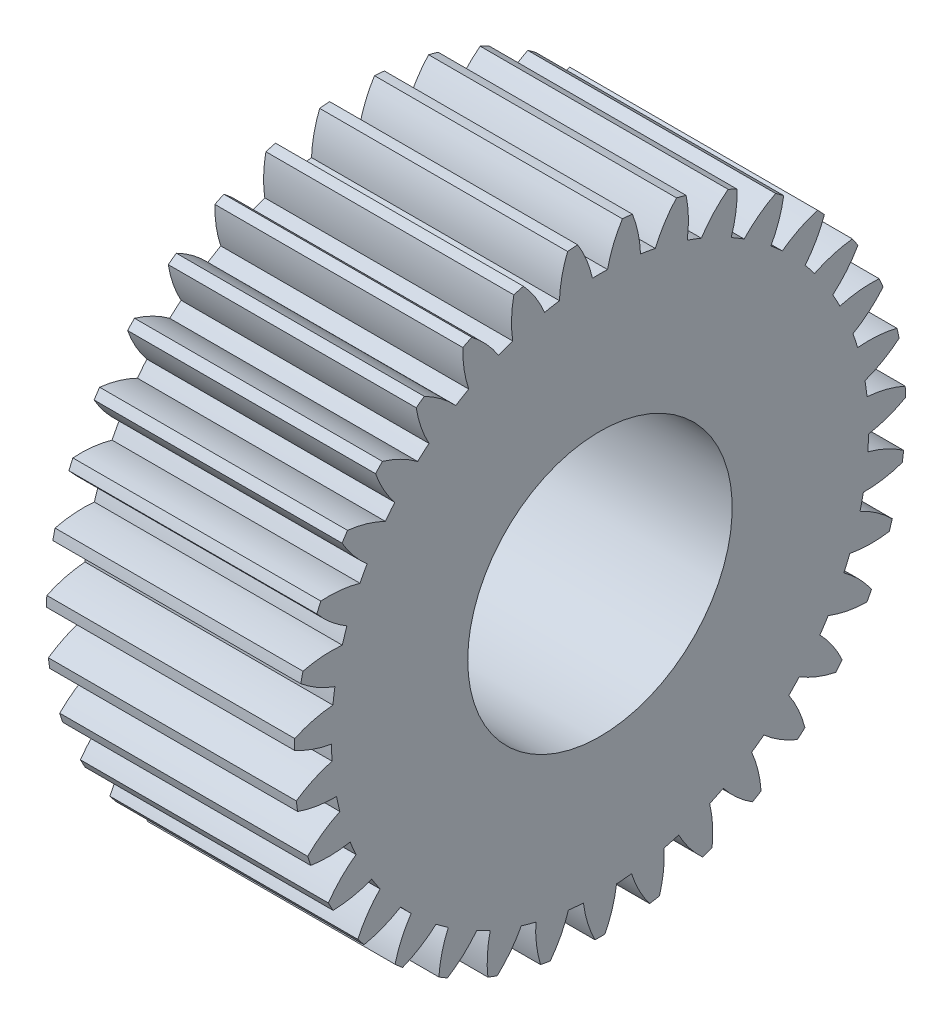
from build123d import *

# Parameters (mm, degrees)
BASPROSKE_W     = 15
BASPROSKE_H     = 18.5
TOOTHCUT_DEPTH  = 31.1579177
TEETHCUTS_COUNT = 35
TEETHCUTS_ANGLE = 349.714285714
BORSKE_R        = 8
BORE_DEPTH      = 50.0000508


with BuildPart() as part:
    # BasProSke → Base-Revolve (revolve)
    with BuildSketch(Plane(origin=(0, 0, 0), x_dir=(1, 0, 0), z_dir=(0, 1, 0))):
        with Locations((7.5, 9.25)):
            Rectangle(BASPROSKE_W, BASPROSKE_H)
    revolve(axis=Axis((-10, 0, 0), (1, 0, 0)))

    # TooCutSke → ToothCut (cut, through all)
    with BuildSketch(Plane(origin=(0, 0, 0), x_dir=(0, 0, -1), z_dir=(1, 0, 0))):
        with BuildLine():
            ThreePointArc((0.456361119, 16.242590173), (0, 16.249), (-0.456361119, 16.242590173))
            ThreePointArc((-0.456361119, 16.242590173), (-0.817781123, 17.39831105), (-1.372969849, 18.474452602))
            ThreePointArc((-1.372969849, 18.474452602), (0, 18.5254), (1.372969849, 18.474452602))
            ThreePointArc((1.372969849, 18.474452602), (0.817781123, 17.39831105), (0.456361119, 16.242590173))
        make_face()
    toothcut = extrude(amount=TOOTHCUT_DEPTH, mode=Mode.SUBTRACT)

    # TeethCuts: ToothCut ×35 about axis
    teethcuts_axis = Axis((-10, 0, 0), (1, 0, 0))
    for i in range(1, TEETHCUTS_COUNT):
        add(toothcut.rotate(teethcuts_axis, i * TEETHCUTS_ANGLE / (TEETHCUTS_COUNT - 1)), mode=Mode.SUBTRACT)

    # BorSke → Bore (cut, symmetric)
    with BuildSketch(Plane(origin=(0, 0, 0), x_dir=(0, 0, -1), z_dir=(1, 0, 0))):
        Circle(BORSKE_R)
    extrude(amount=BORE_DEPTH, both=True, mode=Mode.SUBTRACT)


solid = part.part
